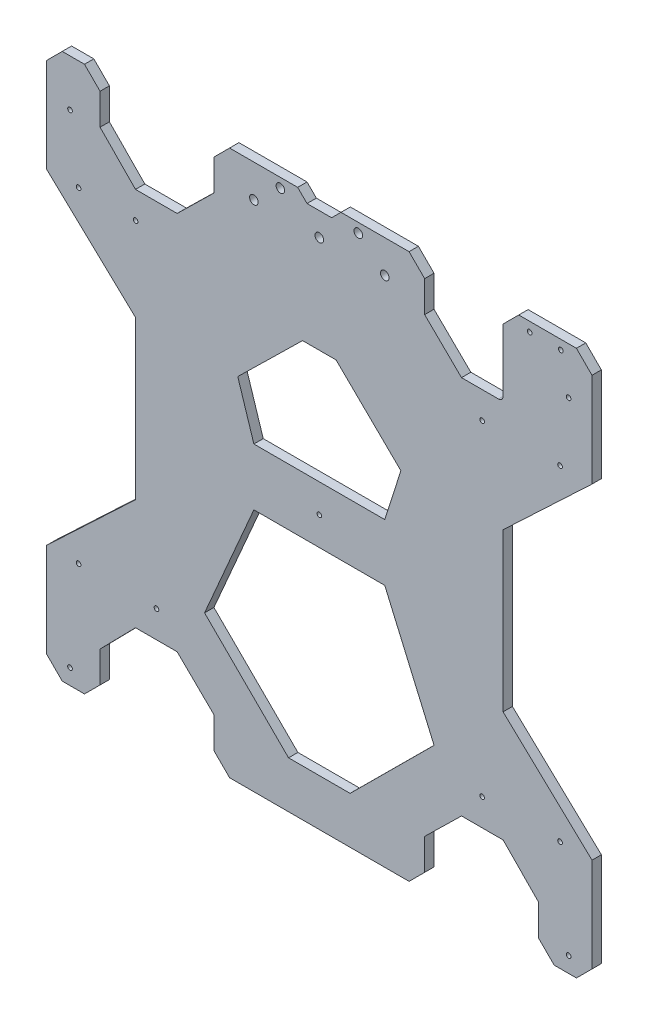
from build123d import *

# Parameters (mm, degrees)
SCHIZZO13_R                  = 1.5
SCHIZZO13_R_2                = 2.75
ESTRUSIONE_ESTRUSIONE2_DEPTH = 6


with BuildPart() as part:
    # Schizzo13 → Estrusione-Estrusione2 (new body)
    with BuildSketch(Plane.XY):
        with BuildLine():
            Line((10, 0), (24.28195797, 0))
            Line((24.28195797, 0), (34.28195797, 10))
            Line((34.28195797, 10), (34.28195797, 30))
            Line((34.28195797, 30), (57.017366293, 53.192694567))
            Line((57.017366293, 53.192694567), (83.745372993, 53.192694567))
            Line((83.745372993, 53.192694567), (107.404551383, 30))
            Line((107.404551383, 30), (107.404551383, 10))
            Line((107.404551383, 10), (117.404551383, 0))
            Line((117.404551383, 0), (232.595448617, 0))
            Line((232.595448617, 0), (242.595448617, 10))
            Line((242.595448617, 10), (242.595448617, 30))
            Line((242.595448617, 30), (266.254627007, 53.192694567))
            Line((266.254627007, 53.192694567), (292.982633707, 53.192694567))
            Line((292.982633707, 53.192694567), (315.71804203, 30))
            Line((315.71804203, 30), (315.71804203, 10))
            Line((315.71804203, 10), (325.71804203, 0))
            Line((325.71804203, 0), (340, 0))
            Line((340, 0), (350, 10))
            Line((350, 10), (350, 70.5))
            Line((350, 70.5), (292.919241786, 124.388863529))
            Line((292.919241786, 124.388863529), (292.919241786, 225.611136471))
            Line((292.919241786, 225.611136471), (350, 279.5))
            Line((350, 279.5), (350, 340))
            Line((350, 340), (340, 350))
            Line((340, 350), (302.982633707, 350))
            Line((302.982633707, 350), (292.982633707, 340))
            Line((292.982633707, 340), (292.982633707, 299.807305433))
            ThreePointArc((292.982633707, 299.807305433), (292.103954051, 297.685985089), (289.982633707, 296.807305433))
            Line((289.982633707, 296.807305433), (266.254627007, 296.807305433))
            Line((266.254627007, 296.807305433), (242.595448617, 320))
            Line((242.595448617, 320), (242.595448617, 340))
            Line((242.595448617, 340), (232.595448617, 350))
            Line((232.595448617, 350), (188.89112909, 350))
            Line((188.89112909, 350), (182.89112909, 344))
            Line((182.89112909, 344), (167.10887091, 344))
            Line((167.10887091, 344), (161.10887091, 350))
            Line((161.10887091, 350), (117.404551383, 350))
            Line((117.404551383, 350), (107.404551383, 340))
            Line((107.404551383, 340), (107.404551383, 320))
            Line((107.404551383, 320), (83.745372993, 296.807305433))
            Line((83.745372993, 296.807305433), (57.017366293, 296.807305433))
            Line((57.017366293, 296.807305433), (34.28195797, 320))
            Line((34.28195797, 320), (34.28195797, 340))
            Line((34.28195797, 340), (24.28195797, 350))
            Line((24.28195797, 350), (10, 350))
            Line((10, 350), (0, 340))
            Line((0, 340), (0, 279.5))
            Line((0, 279.5), (57.080758214, 225.611136471))
            Line((57.080758214, 225.611136471), (57.080758214, 175))
            Line((57.080758214, 175), (57.080758214, 124.388863529))
            Line((57.080758214, 124.388863529), (0, 70.5))
            Line((0, 70.5), (0, 10))
            Line((0, 10), (10, 0))
        make_face()
        with Locations((15, 320)):
            Circle(SCHIZZO13_R, mode=Mode.SUBTRACT)
        with Locations((20.5, 279.5)):
            Circle(SCHIZZO13_R, mode=Mode.SUBTRACT)
        with Locations((57.080758214, 279.5)):
            Circle(SCHIZZO13_R, mode=Mode.SUBTRACT)
        with Locations((175, 175)):
            Circle(SCHIZZO13_R, mode=Mode.SUBTRACT)
        with Locations((20.5, 70.5)):
            Circle(SCHIZZO13_R, mode=Mode.SUBTRACT)
        with Locations((200, 344)):
            Circle(SCHIZZO13_R_2, mode=Mode.SUBTRACT)
        with Locations((150, 344)):
            Circle(SCHIZZO13_R_2, mode=Mode.SUBTRACT)
        with Locations((175, 329)):
            Circle(SCHIZZO13_R_2, mode=Mode.SUBTRACT)
        with Locations((217, 329)):
            Circle(SCHIZZO13_R_2, mode=Mode.SUBTRACT)
        with Locations((133, 329)):
            Circle(SCHIZZO13_R_2, mode=Mode.SUBTRACT)
        with Locations((70.5, 70.5)):
            Circle(SCHIZZO13_R, mode=Mode.SUBTRACT)
        with Locations((279.5, 70.5)):
            Circle(SCHIZZO13_R, mode=Mode.SUBTRACT)
        with Locations((329.5, 70.5)):
            Circle(SCHIZZO13_R, mode=Mode.SUBTRACT)
        with Locations((335, 10)):
            Circle(SCHIZZO13_R, mode=Mode.SUBTRACT)
        with Locations((15, 10)):
            Circle(SCHIZZO13_R, mode=Mode.SUBTRACT)
        with Locations((279.5, 279.5)):
            Circle(SCHIZZO13_R, mode=Mode.SUBTRACT)
        with Locations((329.5, 279.5)):
            Circle(SCHIZZO13_R, mode=Mode.SUBTRACT)
        with Locations((335, 320)):
            Circle(SCHIZZO13_R, mode=Mode.SUBTRACT)
        with Locations((310, 344)):
            Circle(SCHIZZO13_R, mode=Mode.SUBTRACT)
        with Locations((330, 344)):
            Circle(SCHIZZO13_R, mode=Mode.SUBTRACT)
        Polygon((217, 193.286910978), (227.343033378, 225.611136471), (185.750894453, 266.383210572), (164.249105547, 266.383210572), (122.656966622, 225.611136471), (133, 193.286910978), align=None, mode=Mode.SUBTRACT)
        Polygon((133, 156.713089022), (101.348199345, 83.616789428), (155.254193112, 30), (194.745806888, 30), (248.651800655, 83.616789428), (217, 156.713089022), align=None, mode=Mode.SUBTRACT)
    extrude(amount=-ESTRUSIONE_ESTRUSIONE2_DEPTH)


solid = part.part
